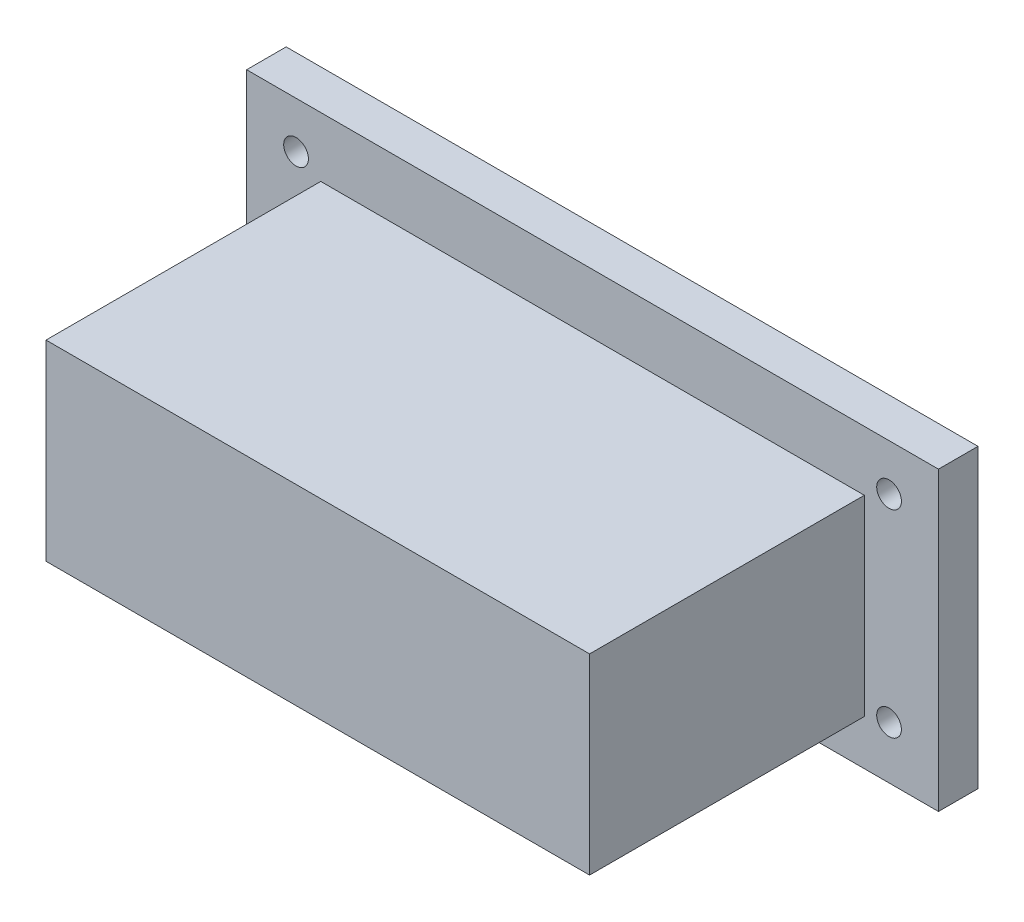
from build123d import *

# Parameters (mm, degrees)
SKETCH2_W           = 70
SKETCH2_H           = 30
SKETCH2_R           = 1.25
BOSS_EXTRUDE1_DEPTH = 4
SKETCH4_W           = 55
SKETCH4_H           = 19.384724032
BOSS_EXTRUDE2_DEPTH = 27.8
SKETCH6_W           = 24.110814092
SKETCH6_H           = 15.243864829
CUT_EXTRUDE3_DEPTH  = 54


with BuildPart() as part:
    # Sketch2 → Boss-Extrude1 (new body)
    with BuildSketch(Plane.XY):
        with Locations((11.09375, 2.8125)):
            Rectangle(SKETCH2_W, SKETCH2_H)
        with Locations((41.09375, 13.125)):
            Circle(SKETCH2_R, mode=Mode.SUBTRACT)
        with Locations((41.09375, -6.875)):
            Circle(SKETCH2_R, mode=Mode.SUBTRACT)
        with Locations((-18.90625, -6.875)):
            Circle(SKETCH2_R, mode=Mode.SUBTRACT)
        with Locations((-18.90625, 13.125)):
            Circle(SKETCH2_R, mode=Mode.SUBTRACT)
    extrude(amount=BOSS_EXTRUDE1_DEPTH)

    # Sketch4 → Boss-Extrude2 (add)
    with BuildSketch(Plane.XY.offset(4)):
        with Locations((11.09375, 2.081024215)):
            Rectangle(SKETCH4_W, SKETCH4_H)
    extrude(amount=BOSS_EXTRUDE2_DEPTH)

    # Sketch6 → Cut-Extrude3 (cut)
    with BuildSketch(Plane.ZY.offset(16.40625)):
        with Locations((18.099511117, 2.174808444)):
            Rectangle(SKETCH6_W, SKETCH6_H)
    extrude(amount=-CUT_EXTRUDE3_DEPTH, mode=Mode.SUBTRACT)


solid = part.part
